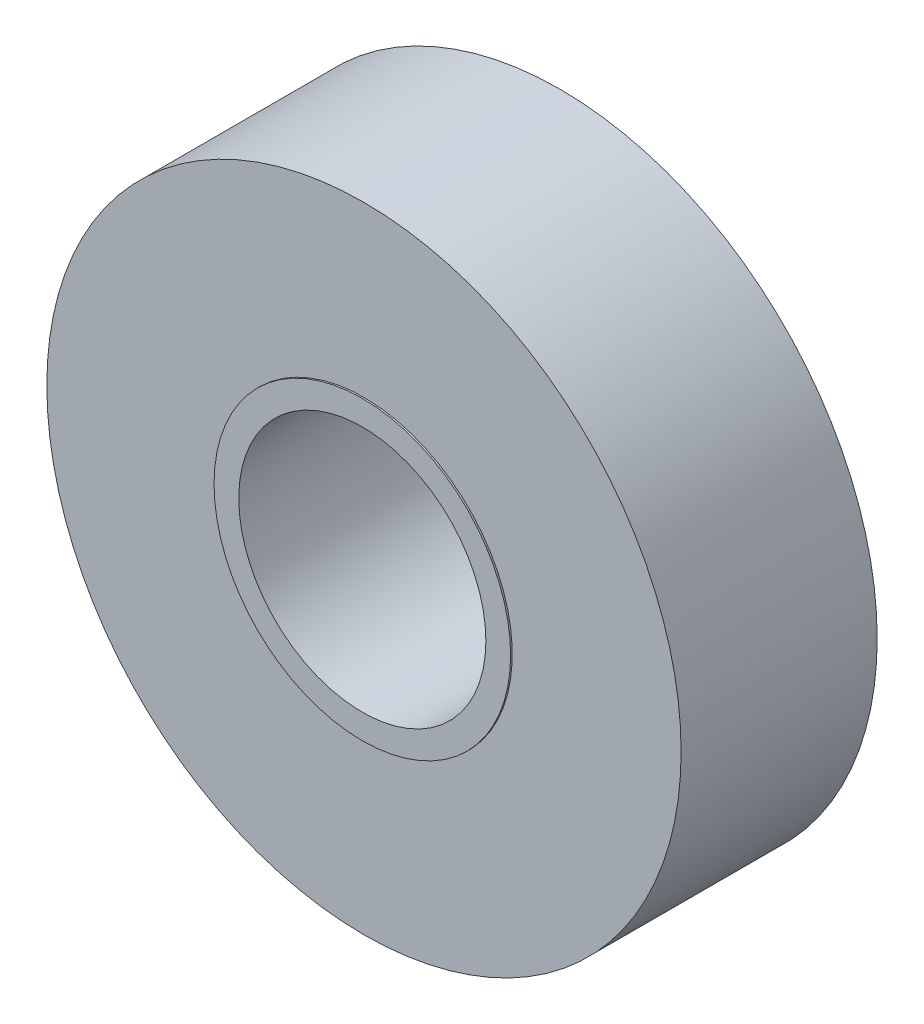
from build123d import *

# Parameters (mm, degrees)
CROQUIS1_R                   = 9
CROQUIS1_R_2                 = 7.5
SALIENTE_EXTRUIR1_DEPTH      = 12
SALIENTE_EXTRUIR2_DEPTH      = 1
SALIENTE_EXTRUIR2_DEPTH_BACK = 0.1
CROQUIS2_R                   = 7.5
CROQUIS3_R                   = 5.2
CROQUIS3_R_2                 = 1.5
SALIENTE_EXTRUIR4_DEPTH      = 3
CROQUIS4_R                   = 19.25
CROQUIS4_R_2                 = 9
SALIENTE_EXTRUIR5_DEPTH      = 11.9
CORTAR_EXTRUIR1_START        = -10
CROQUIS6_R                   = 1.5
CORTAR_EXTRUIR1_DEPTH        = 10
CORTAR_EXTRUIR2_DEPTH        = 10
CORTAR_EXTRUIR2_DEPTH_BACK   = 10
CROQUIS7_R                   = 1


with BuildPart() as part:
    # Croquis1 → Saliente-Extruir1 (new body)
    with BuildSketch(Plane.XY):
        Circle(CROQUIS1_R)
        Circle(CROQUIS1_R_2, mode=Mode.SUBTRACT)
    extrude(amount=SALIENTE_EXTRUIR1_DEPTH)

    # Croquis2 → Saliente-Extruir2 (add, two sides: drawn at the far end of the back side and taken through both)
    with BuildSketch(Plane.XY.offset(-SALIENTE_EXTRUIR2_DEPTH_BACK)):
        Circle(CROQUIS2_R)
    extrude(amount=SALIENTE_EXTRUIR2_DEPTH + SALIENTE_EXTRUIR2_DEPTH_BACK)

    # Croquis3 → Saliente-Extruir4 (add)
    with BuildSketch(Plane.XY):
        Circle(CROQUIS3_R)
        Circle(CROQUIS3_R_2, mode=Mode.SUBTRACT)
    extrude(amount=-SALIENTE_EXTRUIR4_DEPTH)

    # Croquis4 → Saliente-Extruir5 (add)
    with BuildSketch(Plane(origin=(0, 0, 0), x_dir=(-1, 0, 0), z_dir=(0, 0, -1))):
        Circle(CROQUIS4_R)
        Circle(CROQUIS4_R_2, mode=Mode.SUBTRACT)
    extrude(amount=-SALIENTE_EXTRUIR5_DEPTH)

    # Croquis6 → Cortar-Extruir1 (cut)
    with BuildSketch(Plane(origin=(0, 0, -3), x_dir=(-1, 0, 0), z_dir=(0, 0, -1)).offset(CORTAR_EXTRUIR1_START)):
        Circle(CROQUIS6_R)
    extrude(amount=CORTAR_EXTRUIR1_DEPTH, mode=Mode.SUBTRACT)

    # Croquis7 → Cortar-Extruir2 (cut, two sides: drawn at the far end of the back side and taken through both)
    with BuildSketch(Plane(origin=(0, 0, 0), x_dir=(1, 0, 0), z_dir=(0, 1, 0)).offset(-CORTAR_EXTRUIR2_DEPTH_BACK)):
        with Locations((0, 1.55)):
            Circle(CROQUIS7_R)
    extrude(amount=CORTAR_EXTRUIR2_DEPTH + CORTAR_EXTRUIR2_DEPTH_BACK, mode=Mode.SUBTRACT)


solid = part.part
